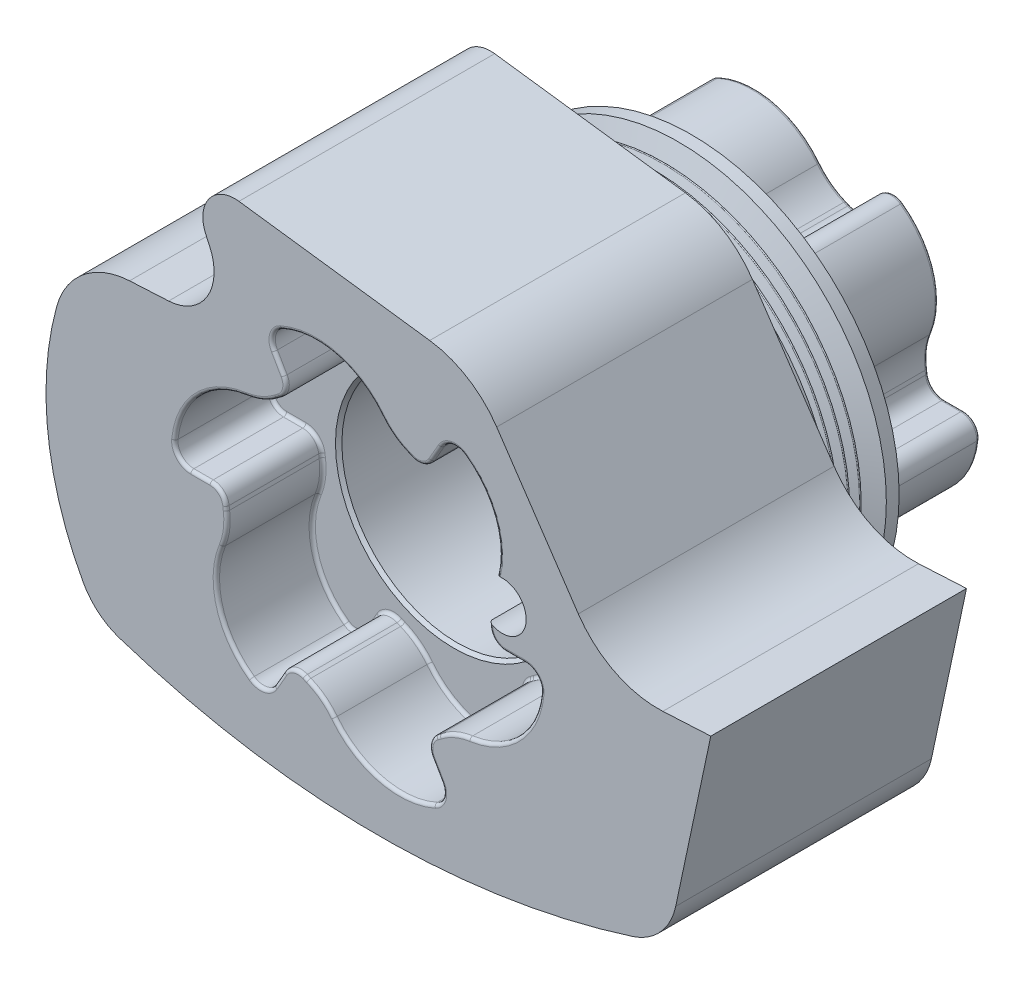
from build123d import *
from OCP.BRepAlgoAPI import BRepAlgoAPI_Cut
from OCP.TopTools import TopTools_ListOfShape

# Parameters (mm, degrees)
RESSALTO_PRINCIPAL_ARMA_DEPTH    = 80
ESBO_O2_R                        = 20
FURO_EIXO_DEPTH                  = 161.937958194
FILETE_REVOLU_O_POLIA_R          = 1
ESBO_O6_R                        = 20
RESSALTO_CAMISA_DEPTH            = 33
FILETE_RESSALTO_CAMISA_R         = 1
ESBO_O2_5_R                      = 36
ESBO_O2_5_R_2                    = 20
REBAIXO_ROLAMENTO_DEPTH          = 63
FILETE_REBAIXO_ROLAMENTO_R       = 1
REBAIXO_START                    = -104.334625
ESBO_O6_2_R                      = 20
REBAIXO_CAMISA_DEPTH             = 30
FILETE_REBAIXO_CAMISA_R          = 1
REBAIXO_START_2                  = -30
ESBO_O2_6_R                      = 36
ESBO_O2_6_R_2                    = 20
REBAIXO_ROLAMENTO_ARMA_II_DEPTH  = 46
CHANFRO_REBAIXO_ARMA_II_SIZE     = 1
FURO_ROSCADO_DE_M122_D           = 10.2
FURO_ROSCADO_DE_M122_DEPTH       = 32.75
FURO_ROSCADO_DE_M122_CSINK_D     = 12.05
FURO_ROSCADO_DE_M122_CSINK_ANGLE = 90
FURO_ROSCADO_DE_M122_TIP         = 3.064389157


with BuildPart() as part:
    # Esboço1 → RESSALTO PRINCIPAL ARMA (new body)
    with BuildSketch(Plane.XY):
        with BuildLine():
            Line((112.973397936, 10.920684904), (97.976789723, 10.134745971))
            ThreePointArc((97.976789723, 10.134745971), (83.020776642, 13.245601165), (71.535583859, 23.317844909))
            Line((71.535583859, 23.317844909), (46, 61.175904846))
            ThreePointArc((46, 61.175904846), (36.915290533, 69.910684492), (25.04465859, 74.143463584))
            Line((25.04465859, 74.143463584), (-34.631660207, 82))
            ThreePointArc((-34.631660207, 82), (-44.001368172, 77.99864787), (-45, 67.859368769))
            Line((-45, 67.859368769), (-43.815274599, 65.318716947))
            ThreePointArc((-43.815274599, 65.318716947), (-44.552381894, 51.253871898), (-56.624852061, 44))
            Line((-56.624852061, 44), (-68.848563686, 43.359382419))
            ThreePointArc((-68.848563686, 43.359382419), (-83.233421821, 37.854416991), (-91.661652202, 24.96280264))
            ThreePointArc((-91.661652202, 24.96280264), (-94.346256705, -11.125818881), (-83.340506358, -45.6))
            ThreePointArc((-83.340506358, -45.6), (-78.5851874, -51.375779671), (-72.040134597, -55))
            ThreePointArc((-72.040134597, -55), (8.207967193, -67.998312053), (88.547659519, -55.578658519))
            ThreePointArc((88.547659519, -55.578658519), (97.277155725, -49.945015038), (102.002702293, -40.692380142))
            Line((102.002702293, -40.692380142), (112.973397936, 10.920684904))
        make_face()
    extrude(amount=RESSALTO_PRINCIPAL_ARMA_DEPTH)

    # Esboço2 → FURO EIXO (cut, through all)
    with BuildSketch(Plane.XY.offset(80)):
        with Locations((2.56, 1.53)):
            Circle(ESBO_O2_R)
    extrude(amount=-FURO_EIXO_DEPTH, mode=Mode.SUBTRACT)

    # Esboço5 → REVOLUÇÃO POLIA (revolve)
    with BuildSketch(Plane(origin=(2.56, 0, 0), x_dir=(0, 0, -1), z_dir=(1, 0, 0)), mode=Mode.PRIVATE) as revolu_o_polia_sk:
        with BuildLine():
            Line((24.334625498, 66.53), (20.334625498, 66.53))
            Line((20.334625498, 66.53), (17.977159059, 60.052914193))
            ThreePointArc((17.977159059, 60.052914193), (17.507312749, 59.723924265), (17.037466439, 60.052914193))
            Line((17.037466439, 60.052914193), (15.962235904, 63.007085807))
            ThreePointArc((15.962235904, 63.007085807), (15.727312749, 63.171580771), (15.492389594, 63.007085807))
            Line((15.492389594, 63.007085807), (14.417159059, 60.052914193))
            ThreePointArc((14.417159059, 60.052914193), (13.947312749, 59.723924265), (13.477466439, 60.052914193))
            Line((13.477466439, 60.052914193), (12.402235904, 63.007085807))
            ThreePointArc((12.402235904, 63.007085807), (12.167312749, 63.171580771), (11.932389594, 63.007085807))
            Line((11.932389594, 63.007085807), (10.857159059, 60.052914193))
            ThreePointArc((10.857159059, 60.052914193), (10.387312749, 59.723924265), (9.917466439, 60.052914193))
            Line((9.917466439, 60.052914193), (8.842235904, 63.007085807))
            ThreePointArc((8.842235904, 63.007085807), (8.607312749, 63.171580771), (8.372389594, 63.007085807))
            Line((8.372389594, 63.007085807), (7.297159059, 60.052914193))
            ThreePointArc((7.297159059, 60.052914193), (6.827312749, 59.723924265), (6.357466439, 60.052914193))
            Line((6.357466439, 60.052914193), (4, 66.53))
            Line((4, 66.53), (0, 66.53))
            Line((0, 66.53), (0, 21.53))
            Line((0, 21.53), (24.334625498, 21.53))
            Line((24.334625498, 21.53), (24.334625498, 66.53))
        make_face()
    revolve(revolu_o_polia_sk.sketch.rotate(Axis((2.56, 1.53, 0), (0, 0, -1)), 90), axis=Axis((2.56, 1.53, 0), (0, 0, -1)))

    # FILETE REVOLUÇÃO POLIA
    filete_revolu_o_polia_edges = [part.edges().sort_by_distance(p)[0] for p in [
        (-62.44, 1.53, 0),
    ]]
    fillet(filete_revolu_o_polia_edges, radius=FILETE_REVOLU_O_POLIA_R)

    # Esboço6 → RESSALTO CAMISA (add)
    with BuildSketch(Plane(origin=(0, 0, -24.334625498), x_dir=(-1, 0, 0), z_dir=(0, 0, -1))):
        with BuildLine():
            Line((-48.790401253, 1.53), (-54.821362401, 1.53))
            ThreePointArc((-54.821362401, 1.53), (-58.52142675, -0.107036454), (-59.798635011, -3.946190476))
            ThreePointArc((-59.798635011, -3.946190476), (-52.701202447, -19.4462866), (-37.527970163, -27.218001398))
            ThreePointArc((-37.527970163, -27.218001398), (-32.516069677, -28.60350449), (-28.03072956, -31.234186785))
            ThreePointArc((-28.03072956, -31.234186785), (-27.545185874, -31.605939505), (-27.054217146, -31.970497405))
            ThreePointArc((-27.054217146, -31.970497405), (-25.11302785, -34.974518444), (-25.675200626, -38.506701912))
            Line((-25.675200626, -38.506701912), (-28.6906812, -43.729667476))
            ThreePointArc((-28.6906812, -43.729667476), (-29.122998219, -47.752535425), (-26.436797437, -50.778207235))
            ThreePointArc((-26.436797437, -50.778207235), (-9.464604151, -52.381698395), (4.852514437, -43.127151179))
            ThreePointArc((4.852514437, -43.127151179), (8.558345555, -39.479469582), (13.079253311, -36.910392244))
            ThreePointArc((13.079253311, -36.910392244), (13.643972452, -36.675775437), (14.20517322, -36.432862997))
            ThreePointArc((14.20517322, -36.432862997), (17.7773264, -36.253754272), (20.555200626, -38.506701912))
            Line((20.555200626, -38.506701912), (23.5706812, -43.729667476))
            ThreePointArc((23.5706812, -43.729667476), (26.838428532, -46.115498971), (30.801837574, -45.302016759))
            ThreePointArc((30.801837574, -45.302016759), (40.676598296, -31.405411795), (39.820484601, -14.379149781))
            ThreePointArc((39.820484601, -14.379149781), (38.514415232, -9.345965093), (38.54998287, -4.146205459))
            ThreePointArc((38.54998287, -4.146205459), (38.629158326, -3.539835933), (38.699390365, -2.932365591))
            ThreePointArc((38.699390365, -2.932365591), (40.33035425, 0.250764172), (43.670401253, 1.53))
            Line((43.670401253, 1.53), (49.701362401, 1.53))
            ThreePointArc((49.701362401, 1.53), (53.40142675, 3.167036454), (54.678635011, 7.006190476))
            ThreePointArc((54.678635011, 7.006190476), (47.581202447, 22.5062866), (32.407970163, 30.278001398))
            ThreePointArc((32.407970163, 30.278001398), (27.396069677, 31.66350449), (22.91072956, 34.294186785))
            ThreePointArc((22.91072956, 34.294186785), (22.425185874, 34.665939505), (21.934217146, 35.030497405))
            ThreePointArc((21.934217146, 35.030497405), (19.99302785, 38.034518444), (20.555200626, 41.566701912))
            Line((20.555200626, 41.566701912), (23.5706812, 46.789667476))
            ThreePointArc((23.5706812, 46.789667476), (24.002998219, 50.812535425), (21.316797437, 53.838207235))
            ThreePointArc((21.316797437, 53.838207235), (4.344604151, 55.441698395), (-9.972514437, 46.187151179))
            ThreePointArc((-9.972514437, 46.187151179), (-13.678345555, 42.539469582), (-18.199253311, 39.970392244))
            ThreePointArc((-18.199253311, 39.970392244), (-18.763972452, 39.735775437), (-19.32517322, 39.492862997))
            ThreePointArc((-19.32517322, 39.492862997), (-22.8973264, 39.313754272), (-25.675200626, 41.566701912))
            Line((-25.675200626, 41.566701912), (-28.6906812, 46.789667476))
            ThreePointArc((-28.6906812, 46.789667476), (-31.958428532, 49.175498971), (-35.921837574, 48.362016759))
            ThreePointArc((-35.921837574, 48.362016759), (-45.796598296, 34.465411795), (-44.940484601, 17.439149781))
            ThreePointArc((-44.940484601, 17.439149781), (-43.634415232, 12.405965093), (-43.66998287, 7.206205459))
            ThreePointArc((-43.66998287, 7.206205459), (-43.749158326, 6.599835933), (-43.819390365, 5.992365591))
            ThreePointArc((-43.819390365, 5.992365591), (-45.45035425, 2.809235828), (-48.790401253, 1.53))
        make_face()
        with Locations(Location((-2.56, 1.53, 0), (0, 0, 180))):
            Circle(ESBO_O6_R, mode=Mode.SUBTRACT)
    extrude(amount=RESSALTO_CAMISA_DEPTH)

    # FILETE RESSALTO CAMISA
    filete_ressalto_camisa_edges = [part.edges().sort_by_distance(p)[0] for p in [
        (9.464604151, -52.381698395, -24.334625498),
        (-8.558345555, -39.479469582, -24.334625498),
        (-13.643972452, -36.675775437, -24.334625498),
        (-17.7773264, -36.253754272, -24.334625498),
        (-22.062940913, -41.118184694, -24.334625498),
        (-26.838428532, -46.115498971, -24.334625498),
        (-40.676598296, -31.405411795, -24.334625498),
        (-38.514415232, -9.345965093, -24.334625498),
        (-38.629158326, -3.539835933, -24.334625498),
        (-40.33035425, 0.250764172, -24.334625498),
        (-46.685881827, 1.53, -24.334625498),
        (-53.40142675, 3.167036454, -24.334625498),
        (-47.581202447, 22.5062866, -24.334625498),
        (-27.396069677, 31.66350449, -24.334625498),
        (-22.425185874, 34.665939505, -24.334625498),
        (-19.99302785, 38.034518444, -24.334625498),
        (-22.062940913, 44.178184694, -24.334625498),
        (-24.002998219, 50.812535425, -24.334625498),
        (-4.344604151, 55.441698395, -24.334625498),
        (13.678345555, 42.539469582, -24.334625498),
        (18.763972452, 39.735775437, -24.334625498),
        (22.8973264, 39.313754272, -24.334625498),
        (27.182940913, 44.178184694, -24.334625498),
        (31.958428532, 49.175498971, -24.334625498),
        (45.796598296, 34.465411795, -24.334625498),
        (43.634415232, 12.405965093, -24.334625498),
        (43.749158326, 6.599835933, -24.334625498),
        (45.45035425, 2.809235828, -24.334625498),
        (51.805881827, 1.53, -24.334625498),
        (58.52142675, -0.107036454, -24.334625498),
        (52.701202447, -19.4462866, -24.334625498),
        (32.516069677, -28.60350449, -57.334625498),
        (27.545185874, -31.605939505, -57.334625498),
        (25.11302785, -34.974518444, -57.334625498),
        (27.182940913, -41.118184694, -57.334625498),
        (29.122998219, -47.752535425, -57.334625498),
        (9.464604151, -52.381698395, -57.334625498),
        (-8.558345555, -39.479469582, -57.334625498),
        (-13.643972452, -36.675775437, -57.334625498),
        (-17.7773264, -36.253754272, -57.334625498),
        (-22.062940913, -41.118184694, -57.334625498),
        (-26.838428532, -46.115498971, -57.334625498),
        (-40.676598296, -31.405411795, -57.334625498),
        (-38.514415232, -9.345965093, -57.334625498),
        (-38.629158326, -3.539835933, -57.334625498),
        (-40.33035425, 0.250764172, -57.334625498),
        (-46.685881827, 1.53, -57.334625498),
        (-53.40142675, 3.167036454, -57.334625498),
        (-47.581202447, 22.5062866, -57.334625498),
        (-27.396069677, 31.66350449, -57.334625498),
        (-22.425185874, 34.665939505, -57.334625498),
        (-19.99302785, 38.034518444, -57.334625498),
        (-22.062940913, 44.178184694, -57.334625498),
        (-24.002998219, 50.812535425, -57.334625498),
        (-4.344604151, 55.441698395, -57.334625498),
        (13.678345555, 42.539469582, -57.334625498),
        (18.763972452, 39.735775437, -57.334625498),
        (22.8973264, 39.313754272, -57.334625498),
        (27.182940913, 44.178184694, -57.334625498),
        (31.958428532, 49.175498971, -57.334625498),
        (45.796598296, 34.465411795, -57.334625498),
        (43.634415232, 12.405965093, -57.334625498),
        (43.749158326, 6.599835933, -57.334625498),
        (45.45035425, 2.809235828, -57.334625498),
        (51.805881827, 1.53, -57.334625498),
        (58.52142675, -0.107036454, -57.334625498),
        (52.701202447, -19.4462866, -57.334625498),
        (32.516069677, -28.60350449, -24.334625498),
        (27.545185874, -31.605939505, -24.334625498),
        (25.11302785, -34.974518444, -24.334625498),
        (27.182940913, -41.118184694, -24.334625498),
        (29.122998219, -47.752535425, -24.334625498),
    ]]
    fillet(filete_ressalto_camisa_edges, radius=FILETE_RESSALTO_CAMISA_R)

    # Esboço2<5> → REBAIXO ROLAMENTO (cut)
    with BuildSketch(Plane.XY.offset(80)):
        with Locations((2.56, 1.53)):
            Circle(ESBO_O2_5_R)
        with Locations((2.56, 1.53)):
            Circle(ESBO_O2_5_R_2, mode=Mode.SUBTRACT)
    extrude(amount=-REBAIXO_ROLAMENTO_DEPTH, mode=Mode.SUBTRACT)

    # FILETE REBAIXO ROLAMENTO
    filete_rebaixo_rolamento_edges = [part.edges().sort_by_distance(p)[0] for p in [
        (-33.44, 1.53, 17),
    ]]
    fillet(filete_rebaixo_rolamento_edges, radius=FILETE_REBAIXO_ROLAMENTO_R)


with BuildPart() as rebaixo_camisa_tool:
    # Esboço6<2> → REBAIXO CAMISA (new body)
    with BuildSketch(Plane(origin=(0, 0, -24.334625498), x_dir=(-1, 0, 0), z_dir=(0, 0, -1)).offset(REBAIXO_START)):
        with BuildLine():
            Line((-48.790401253, 1.53), (-54.821362401, 1.53))
            ThreePointArc((-54.821362401, 1.53), (-58.52142675, -0.107036454), (-59.798635011, -3.946190476))
            ThreePointArc((-59.798635011, -3.946190476), (-52.701202447, -19.4462866), (-37.527970163, -27.218001398))
            ThreePointArc((-37.527970163, -27.218001398), (-32.516069677, -28.60350449), (-28.03072956, -31.234186785))
            ThreePointArc((-28.03072956, -31.234186785), (-27.545185874, -31.605939505), (-27.054217146, -31.970497405))
            ThreePointArc((-27.054217146, -31.970497405), (-25.11302785, -34.974518444), (-25.675200626, -38.506701912))
            Line((-25.675200626, -38.506701912), (-28.6906812, -43.729667476))
            ThreePointArc((-28.6906812, -43.729667476), (-29.122998219, -47.752535425), (-26.436797437, -50.778207235))
            ThreePointArc((-26.436797437, -50.778207235), (-9.464604151, -52.381698395), (4.852514437, -43.127151179))
            ThreePointArc((4.852514437, -43.127151179), (8.558345555, -39.479469582), (13.079253311, -36.910392244))
            ThreePointArc((13.079253311, -36.910392244), (13.643972452, -36.675775437), (14.20517322, -36.432862997))
            ThreePointArc((14.20517322, -36.432862997), (17.7773264, -36.253754272), (20.555200626, -38.506701912))
            Line((20.555200626, -38.506701912), (23.5706812, -43.729667476))
            ThreePointArc((23.5706812, -43.729667476), (26.838428532, -46.115498971), (30.801837574, -45.302016759))
            ThreePointArc((30.801837574, -45.302016759), (40.676598296, -31.405411795), (39.820484601, -14.379149781))
            ThreePointArc((39.820484601, -14.379149781), (38.514415232, -9.345965093), (38.54998287, -4.146205459))
            ThreePointArc((38.54998287, -4.146205459), (38.629158326, -3.539835933), (38.699390365, -2.932365591))
            ThreePointArc((38.699390365, -2.932365591), (40.33035425, 0.250764172), (43.670401253, 1.53))
            Line((43.670401253, 1.53), (49.701362401, 1.53))
            ThreePointArc((49.701362401, 1.53), (53.40142675, 3.167036454), (54.678635011, 7.006190476))
            ThreePointArc((54.678635011, 7.006190476), (47.581202447, 22.5062866), (32.407970163, 30.278001398))
            ThreePointArc((32.407970163, 30.278001398), (27.396069677, 31.66350449), (22.91072956, 34.294186785))
            ThreePointArc((22.91072956, 34.294186785), (22.425185874, 34.665939505), (21.934217146, 35.030497405))
            ThreePointArc((21.934217146, 35.030497405), (19.99302785, 38.034518444), (20.555200626, 41.566701912))
            Line((20.555200626, 41.566701912), (23.5706812, 46.789667476))
            ThreePointArc((23.5706812, 46.789667476), (24.002998219, 50.812535425), (21.316797437, 53.838207235))
            ThreePointArc((21.316797437, 53.838207235), (4.344604151, 55.441698395), (-9.972514437, 46.187151179))
            ThreePointArc((-9.972514437, 46.187151179), (-13.678345555, 42.539469582), (-18.199253311, 39.970392244))
            ThreePointArc((-18.199253311, 39.970392244), (-18.763972452, 39.735775437), (-19.32517322, 39.492862997))
            ThreePointArc((-19.32517322, 39.492862997), (-22.8973264, 39.313754272), (-25.675200626, 41.566701912))
            Line((-25.675200626, 41.566701912), (-28.6906812, 46.789667476))
            ThreePointArc((-28.6906812, 46.789667476), (-31.958428532, 49.175498971), (-35.921837574, 48.362016759))
            ThreePointArc((-35.921837574, 48.362016759), (-45.796598296, 34.465411795), (-44.940484601, 17.439149781))
            ThreePointArc((-44.940484601, 17.439149781), (-43.634415232, 12.405965093), (-43.66998287, 7.206205459))
            ThreePointArc((-43.66998287, 7.206205459), (-43.749158326, 6.599835933), (-43.819390365, 5.992365591))
            ThreePointArc((-43.819390365, 5.992365591), (-45.45035425, 2.809235828), (-48.790401253, 1.53))
        make_face()
        with Locations(Location((-2.56, 1.53, 0), (0, 0, 180))):
            Circle(ESBO_O6_2_R, mode=Mode.SUBTRACT)
    extrude(amount=REBAIXO_CAMISA_DEPTH)


with BuildPart() as part_1:
    add(part.part)

    # REBAIXO CAMISA: cut by rebaixo_camisa_tool, with a tolerance
    rebaixo_camisa_stock = TopTools_ListOfShape()
    rebaixo_camisa_stock.Append(part_1.part.wrapped)
    rebaixo_camisa_tools = TopTools_ListOfShape()
    rebaixo_camisa_tools.Append(rebaixo_camisa_tool.part.wrapped)
    rebaixo_camisa_cut = BRepAlgoAPI_Cut()
    rebaixo_camisa_cut.SetArguments(rebaixo_camisa_stock)
    rebaixo_camisa_cut.SetTools(rebaixo_camisa_tools)
    rebaixo_camisa_cut.SetFuzzyValue(0.00001)
    rebaixo_camisa_cut.Build()
    add(Compound.cast(rebaixo_camisa_cut.Shape()).solids(), mode=Mode.REPLACE)

    # FILETE REBAIXO CAMISA
    filete_rebaixo_camisa_edges = [part_1.edges().sort_by_distance(p)[0] for p in [
        (45.45035425, 2.809235828, 49.999999502),
        (32.516069677, -28.60350449, 49.999999502),
        (25.11302785, -34.974518444, 49.999999502),
        (-8.558345555, -39.479469582, 49.999999502),
        (-17.7773264, -36.253754272, 49.999999502),
        (-38.514415232, -9.345965093, 49.999999502),
        (-40.33035425, 0.250764172, 49.999999502),
        (-27.396069677, 31.66350449, 49.999999502),
        (-19.99302785, 38.034518444, 49.999999502),
        (13.678345555, 42.539469582, 49.999999502),
        (22.8973264, 39.313754272, 49.999999502),
        (43.634415232, 12.405965093, 49.999999502),
        (43.749158326, 6.599835933, 79.999999502),
        (45.796598296, 34.465411795, 79.999999502),
        (31.958428532, 49.175498971, 79.999999502),
        (27.182940913, 44.178184694, 79.999999502),
        (18.763972452, 39.735775437, 79.999999502),
        (-4.344604151, 55.441698395, 79.999999502),
        (-24.002998219, 50.812535425, 79.999999502),
        (-22.062940913, 44.178184694, 79.999999502),
        (-22.425185874, 34.665939505, 79.999999502),
        (-47.581202447, 22.5062866, 79.999999502),
        (-53.40142675, 3.167036454, 79.999999502),
        (-46.685881827, 1.53, 79.999999502),
        (-38.629158326, -3.539835933, 79.999999502),
        (-40.676598296, -31.405411795, 79.999999502),
        (-26.838428532, -46.115498971, 79.999999502),
        (-22.062940913, -41.118184694, 79.999999502),
        (-13.643972452, -36.675775437, 79.999999502),
        (9.464604151, -52.381698395, 79.999999502),
        (29.122998219, -47.752535425, 79.999999502),
        (27.182940913, -41.118184694, 79.999999502),
        (27.545185874, -31.605939505, 79.999999502),
        (52.701202447, -19.4462866, 79.999999502),
        (58.52142675, -0.107036454, 79.999999502),
        (51.805881827, 1.53, 79.999999502),
        (45.45035425, 2.809235828, 79.999999502),
        (51.805881827, 1.53, 49.999999502),
        (58.52142675, -0.107036454, 49.999999502),
        (52.701202447, -19.4462866, 49.999999502),
        (32.516069677, -28.60350449, 79.999999502),
        (27.545185874, -31.605939505, 49.999999502),
        (25.11302785, -34.974518444, 79.999999502),
        (27.182940913, -41.118184694, 49.999999502),
        (29.122998219, -47.752535425, 49.999999502),
        (9.464604151, -52.381698395, 49.999999502),
        (-8.558345555, -39.479469582, 79.999999502),
        (-13.643972452, -36.675775437, 49.999999502),
        (-17.7773264, -36.253754272, 79.999999502),
        (-22.062940913, -41.118184694, 49.999999502),
        (-26.838428532, -46.115498971, 49.999999502),
        (-40.676598296, -31.405411795, 49.999999502),
        (-38.514415232, -9.345965093, 79.999999502),
        (-38.629158326, -3.539835933, 49.999999502),
        (-40.33035425, 0.250764172, 79.999999502),
        (-46.685881827, 1.53, 49.999999502),
        (-53.40142675, 3.167036454, 49.999999502),
        (-47.581202447, 22.5062866, 49.999999502),
        (-27.396069677, 31.66350449, 79.999999502),
        (-22.425185874, 34.665939505, 49.999999502),
        (-19.99302785, 38.034518444, 79.999999502),
        (-22.062940913, 44.178184694, 49.999999502),
        (-24.002998219, 50.812535425, 49.999999502),
        (-4.344604151, 55.441698395, 49.999999502),
        (13.678345555, 42.539469582, 79.999999502),
        (18.763972452, 39.735775437, 49.999999502),
        (22.8973264, 39.313754272, 79.999999502),
        (27.182940913, 44.178184694, 49.999999502),
        (31.958428532, 49.175498971, 49.999999502),
        (45.796598296, 34.465411795, 49.999999502),
        (43.634415232, 12.405965093, 79.999999502),
        (43.749158326, 6.599835933, 49.999999502),
    ]]
    fillet(filete_rebaixo_camisa_edges, radius=FILETE_REBAIXO_CAMISA_R)

    # Esboço2<6> → REBAIXO ROLAMENTO ARMA II (cut)
    with BuildSketch(Plane.XY.offset(80).offset(REBAIXO_START_2)):
        with Locations((2.56, 1.53)):
            Circle(ESBO_O2_6_R)
        with Locations((2.56, 1.53)):
            Circle(ESBO_O2_6_R_2, mode=Mode.SUBTRACT)
    extrude(amount=-REBAIXO_ROLAMENTO_ARMA_II_DEPTH, mode=Mode.SUBTRACT)

    # CHANFRO REBAIXO ARMA II
    chanfro_rebaixo_arma_ii_edges = [part_1.edges().sort_by_distance(p)[0] for p in [
        (-33.44, 1.53, 49.999999502),
    ]]
    chamfer(chanfro_rebaixo_arma_ii_edges, length=CHANFRO_REBAIXO_ARMA_II_SIZE)

    # Furo roscado de M122
    with Locations(Plane(origin=(0, 0, -57.334625498), x_dir=(-1, 0, 0), z_dir=(0, 0, -1))):
        with Locations((-47.717032379, -10.569790359), (-35.61724202, 34.58724202), (9.539790359, 46.687032379), (42.597032379, 13.629790359), (30.49724202, -31.52724202), (-14.659790359, -43.627032379)):
            CounterSinkHole(FURO_ROSCADO_DE_M122_D / 2, FURO_ROSCADO_DE_M122_CSINK_D / 2, depth=FURO_ROSCADO_DE_M122_DEPTH, counter_sink_angle=FURO_ROSCADO_DE_M122_CSINK_ANGLE)
            with Locations((0, 0, -(FURO_ROSCADO_DE_M122_DEPTH + FURO_ROSCADO_DE_M122_TIP / 2))):  # 118° drill point
                Cone(0, FURO_ROSCADO_DE_M122_D / 2, FURO_ROSCADO_DE_M122_TIP, mode=Mode.SUBTRACT)

    # Esboço18 → Rebaixo para parafuso Allen sextavado de M121 (revolve, cut)
    with BuildSketch(Plane(origin=(47.717032379, 13.629790359, -24.334625498), x_dir=(0, 1, 0), z_dir=(1, 0, 0))):
        Polygon((0, 0), (0, 104.334625498), (7.5, 104.334625498), (7.5, 12.6), (10, 12.6), (10, 0.025), (10.025, 0), align=None)
    revolve(axis=Axis((47.717032379, 13.629790359, -30.684625498), (0, 0, 1)), mode=Mode.SUBTRACT)


solid = part_1.part
